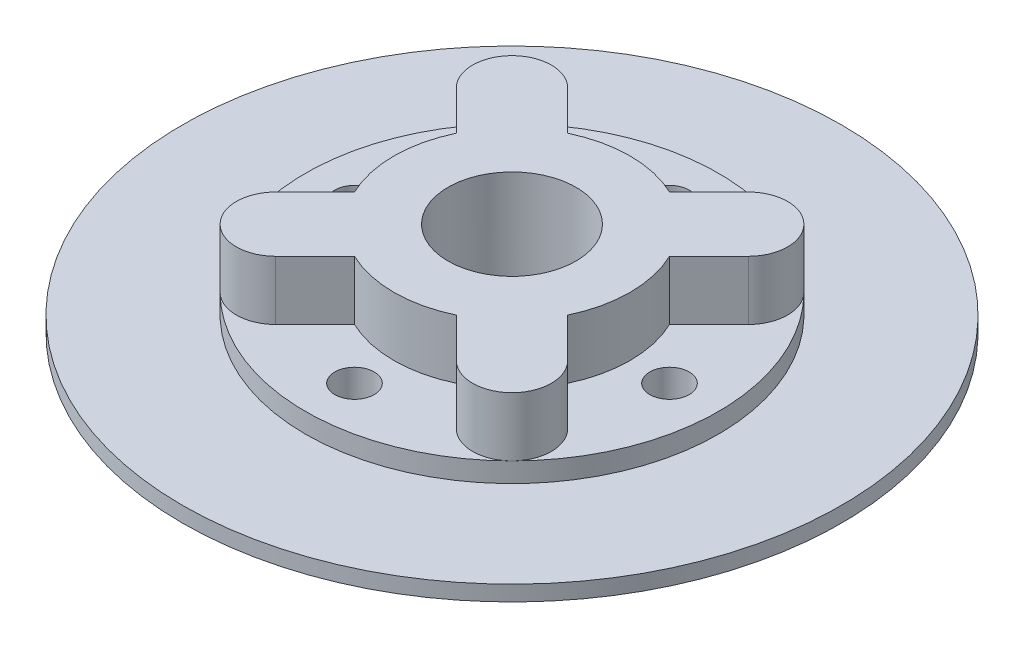
from build123d import *

# Parameters (mm, degrees)
SKETCH1_R           = 53.147403494
BOSS_EXTRUDE1_DEPTH = 2.4892
BOSS_EXTRUDE2_DEPTH = 12.7
SKETCH3_R           = 33.290768363
BOSS_EXTRUDE3_DEPTH = 3.175
SKETCH4_R           = 10.31875
CUT_EXTRUDE1_DEPTH  = 77.681189303
BOSS_EXTRUDE4_START = 3.175
SKETCH5_R           = 10.31875
BOSS_EXTRUDE4_DEPTH = 3.175
SKETCH6_R           = 3.175
CUT_EXTRUDE2_DEPTH  = 76.762910591


with BuildPart() as part:
    # Sketch1 → Boss-Extrude1 (new body)
    with BuildSketch(Plane(origin=(0, 0, 0), x_dir=(1, 0, 0), z_dir=(0, 1, 0))):
        Circle(SKETCH1_R)
    extrude(amount=BOSS_EXTRUDE1_DEPTH)

    # Sketch2 → Boss-Extrude2 (add)
    with BuildSketch(Plane(origin=(0, 2.4892, 0), x_dir=(1, 0, 0), z_dir=(0, 1, 0))):
        with BuildLine():
            Line((-8.209871939, 17.190128061), (-14.559871939, 23.540128061))
            ThreePointArc((-14.559871939, 23.540128061), (-23.540128061, 23.540128061), (-23.540128061, 14.559871939))
            Line((-23.540128061, 14.559871939), (-17.190128061, 8.209871939))
            ThreePointArc((-17.190128061, 8.209871939), (-19.05, 0), (-17.190128061, -8.209871939))
            Line((-17.190128061, -8.209871939), (-23.540128061, -14.559871939))
            ThreePointArc((-23.540128061, -14.559871939), (-23.540128061, -23.540128061), (-14.559871939, -23.540128061))
            Line((-14.559871939, -23.540128061), (-8.209871939, -17.190128061))
            ThreePointArc((-8.209871939, -17.190128061), (0, -19.05), (8.209871939, -17.190128061))
            Line((8.209871939, -17.190128061), (14.559871939, -23.540128061))
            ThreePointArc((14.559871939, -23.540128061), (23.540128061, -23.540128061), (23.540128061, -14.559871939))
            Line((23.540128061, -14.559871939), (17.190128061, -8.209871939))
            ThreePointArc((17.190128061, -8.209871939), (19.05, 0), (17.190128061, 8.209871939))
            Line((17.190128061, 8.209871939), (23.540128061, 14.559871939))
            ThreePointArc((23.540128061, 14.559871939), (23.540128061, 23.540128061), (14.559871939, 23.540128061))
            Line((14.559871939, 23.540128061), (8.209871939, 17.190128061))
            ThreePointArc((8.209871939, 17.190128061), (0, 19.05), (-8.209871939, 17.190128061))
        make_face()
    extrude(amount=BOSS_EXTRUDE2_DEPTH)

    # Sketch3 → Boss-Extrude3 (add)
    with BuildSketch(Plane(origin=(0, 2.4892, 0), x_dir=(1, 0, 0), z_dir=(0, 1, 0))):
        Circle(SKETCH3_R)
    extrude(amount=BOSS_EXTRUDE3_DEPTH)

    # Sketch4 → Cut-Extrude1 (cut, through all)
    with BuildSketch(Plane(origin=(0, 15.1892, 0), x_dir=(1, 0, 0), z_dir=(0, 1, 0))):
        Circle(SKETCH4_R)
    extrude(amount=-CUT_EXTRUDE1_DEPTH, mode=Mode.SUBTRACT)

    # Sketch5 → Boss-Extrude4 (add)
    with BuildSketch(Plane.XZ.offset(BOSS_EXTRUDE4_START)):
        with BuildLine():
            ThreePointArc((33.290768363, 0), (12.739825503, 30.756659512), (-23.540128061, 23.540128061))
            ThreePointArc((-23.540128061, 23.540128061), (-33.290768363, 0), (-23.540128061, -23.540128061))
            ThreePointArc((-23.540128061, -23.540128061), (12.739825503, -30.756659512), (33.290768363, 0))
        make_face()
        Circle(SKETCH5_R, mode=Mode.SUBTRACT)
    extrude(amount=-BOSS_EXTRUDE4_DEPTH)

    # Sketch6 → Cut-Extrude2 (cut, through all)
    with BuildSketch(Plane(origin=(0, 5.6642, 0), x_dir=(1, 0, 0), z_dir=(0, 1, 0))):
        with Locations((0, 25.4)):
            Circle(SKETCH6_R)
        with Locations((25.4, 0)):
            Circle(SKETCH6_R)
        with Locations((0, -25.4)):
            Circle(SKETCH6_R)
        with Locations((-25.4, 0)):
            Circle(SKETCH6_R)
    extrude(amount=-CUT_EXTRUDE2_DEPTH, mode=Mode.SUBTRACT)


solid = part.part
